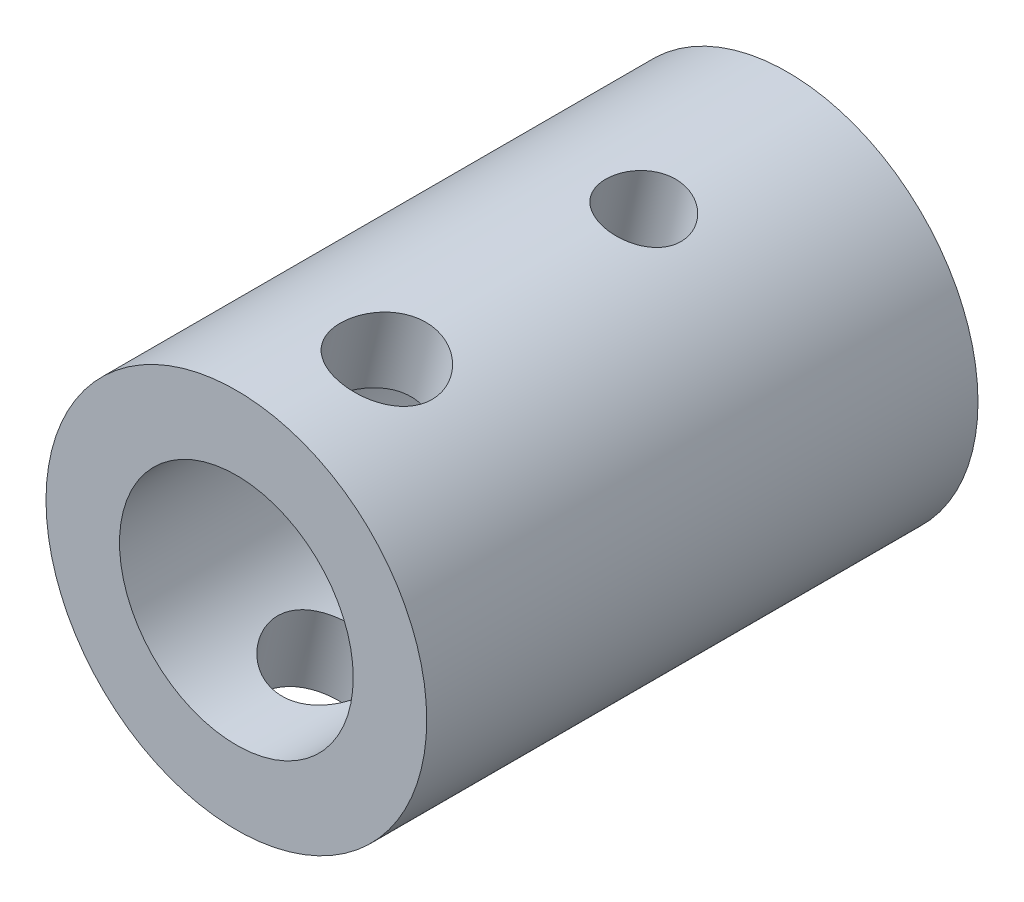
from build123d import *

# Parameters (mm, degrees)
SKETCH1_R                        = 25.9
BOSS_EXTRUDE1_DEPTH              = 75
SKETCH2_R                        = 15.9
CUT_EXTRUDE1_DEPTH               = 75
F_10_5_10_5_DIAMETER_HOLE1_D     = 10.5
F_10_5_10_5_DIAMETER_HOLE1_DEPTH = 20
F_10_5_10_5_DIAMETER_HOLE1_TIP   = 3.15451825
F_12_8_12_8_DIAMETER_HOLE1_D     = 12.8
F_12_8_12_8_DIAMETER_HOLE1_DEPTH = 300
F_12_8_12_8_DIAMETER_HOLE1_TIP   = 3.845507962


with BuildPart() as part:
    # Sketch1 → Boss-Extrude1 (new body)
    with BuildSketch(Plane.XY):
        Circle(SKETCH1_R)
    extrude(amount=BOSS_EXTRUDE1_DEPTH)

    # Sketch2 → Cut-Extrude1 (cut)
    with BuildSketch(Plane.XY.offset(75)):
        Circle(SKETCH2_R)
    extrude(amount=-CUT_EXTRUDE1_DEPTH, mode=Mode.SUBTRACT)

    # Ø10.5 (10.5) Diameter Hole1
    with Locations(Plane(origin=(5.482930922, 25.312990114, 25), x_dir=(0.977335525633, -0.21169617459, 0), z_dir=(0.21169617459, 0.977335525633, 0))):
        with Locations((0, 0)):
            Hole(F_10_5_10_5_DIAMETER_HOLE1_D / 2, depth=F_10_5_10_5_DIAMETER_HOLE1_DEPTH)
            with Locations((0, 0, -(F_10_5_10_5_DIAMETER_HOLE1_DEPTH + F_10_5_10_5_DIAMETER_HOLE1_TIP / 2))):  # 118° drill point
                Cone(0, F_10_5_10_5_DIAMETER_HOLE1_D / 2, F_10_5_10_5_DIAMETER_HOLE1_TIP, mode=Mode.SUBTRACT)

    # Ø12.8 (12.8) Diameter Hole1
    with Locations(Plane(origin=(5.555888051, 25.297077064, 60), x_dir=(0.976721122149, -0.214513052161, 0), z_dir=(0.214513052161, 0.976721122149, 0))):
        with Locations((0, 0)):
            Hole(F_12_8_12_8_DIAMETER_HOLE1_D / 2, depth=F_12_8_12_8_DIAMETER_HOLE1_DEPTH)
            with Locations((0, 0, -(F_12_8_12_8_DIAMETER_HOLE1_DEPTH + F_12_8_12_8_DIAMETER_HOLE1_TIP / 2))):  # 118° drill point
                Cone(0, F_12_8_12_8_DIAMETER_HOLE1_D / 2, F_12_8_12_8_DIAMETER_HOLE1_TIP, mode=Mode.SUBTRACT)


solid = part.part
